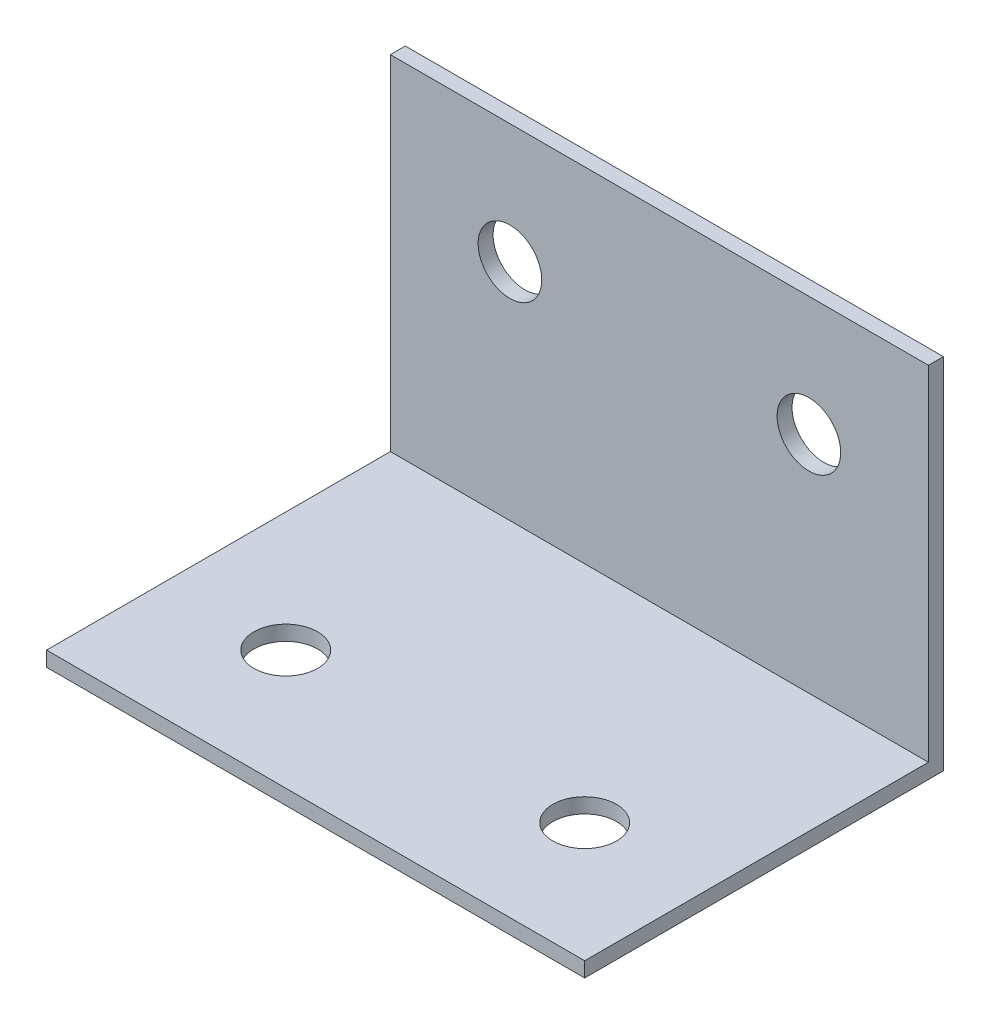
from build123d import *

# Parameters (mm, degrees)
SKETCH1_W                    = 57.15
SKETCH1_H                    = 38.1
BASE_FLANGE1_DEPTH           = 1.5875
EDGE_FLANGE1_STRIP_W         = 7.9375
EDGE_FLANGE1_STRIP_H         = 1.5875
EDGE_FLANGE1_STRIP_CUT_DEPTH = 57.15
EDGE_FLANGE1_DEPTH           = 57.15
F_1_4_CLEARANCE_HOLE1_D      = 6.7564
F_1_4_CLEARANCE_HOLE2_D      = 6.7564
BOSS_EXTRUDE1_DEPTH          = 57.15
CUT_EXTRUDE1_DEPTH           = 79.545162168
BOSS_EXTRUDE2_DEPTH          = 3.175
BOSS_EXTRUDE3_DEPTH          = 3.175


# Sheet-metal steps are written as plain solids
with BuildPart() as part:
    # Sketch1 → Base-Flange1 (new body)
    with BuildSketch(Plane(origin=(0, 0, 0), x_dir=(1, 0, 0), z_dir=(0, 1, 0))):
        with Locations((0, -19.05)):
            Rectangle(SKETCH1_W, SKETCH1_H)
    extrude(amount=BASE_FLANGE1_DEPTH)

    # Edge-Flange1 strip (across the edge) → Edge-Flange1 strip cut (cut)
    with BuildSketch(Plane(origin=(28.575, 1.5875, 0), x_dir=(0, 0, 1), z_dir=(-1, 0, 0))):
        with Locations((-1.5875, -0.79375)):
            Rectangle(EDGE_FLANGE1_STRIP_W, EDGE_FLANGE1_STRIP_H)
    extrude(amount=EDGE_FLANGE1_STRIP_CUT_DEPTH, mode=Mode.SUBTRACT)

    # Edge-Flange1 section (across the edge) → Edge-Flange1 (add)
    with BuildSketch(Plane(origin=(28.575, 1.5875, 0), x_dir=(0, 0, 1), z_dir=(-1, 0, 0))):
        with BuildLine():
            Line((0, 0.79375), (0, 36.5125))
            Line((0, 36.5125), (1.5875, 36.5125))
            Line((1.5875, 36.5125), (1.5875, 0.79375))
            ThreePointArc((1.5875, 0.79375), (1.819983992, 0.232483992), (2.38125, 0))
            Line((2.38125, 0), (2.38125, -1.5875))
            ThreePointArc((2.38125, -1.5875), (0.697451977, -0.890048023), (0, 0.79375))
        make_face()
    extrude(amount=EDGE_FLANGE1_DEPTH)

    # 1/4 Clearance Hole1 (through all)
    with Locations(Plane(origin=(0, 1.5875, 0), x_dir=(1, 0, 0), z_dir=(0, 1, 0))):
        with Locations((-15.875, -25.4), (15.875, -25.4)):
            Hole(F_1_4_CLEARANCE_HOLE1_D / 2)

    # 1/4 Clearance Hole2 (through all)
    with Locations(Plane.XY.offset(1.5875)):
        with Locations((-15.875, 25.4), (15.875, 25.4)):
            Hole(F_1_4_CLEARANCE_HOLE2_D / 2)

    # Sketch16 → Boss-Extrude1 (add, through all)
    with BuildSketch(Plane(origin=(28.575, 0, 0), x_dir=(0, 0, -1), z_dir=(1, 0, 0))):
        with BuildLine():
            Line((0, 2.38125), (0, 0))
            Line((0, 0), (-2.38125, 0))
            ThreePointArc((-2.38125, 0), (-0.697451977, 0.697451977), (0, 2.38125))
        make_face()
    extrude(amount=-BOSS_EXTRUDE1_DEPTH)

    # Sketch18 → Cut-Extrude1 (cut, through all)
    with BuildSketch(Plane(origin=(28.575, 0, 0), x_dir=(0, 0, -1), z_dir=(1, 0, 0))):
        with BuildLine():
            Line((-2.38125, 1.5875), (-1.5875, 1.5875))
            Line((-1.5875, 1.5875), (-1.5875, 2.38125))
            ThreePointArc((-1.5875, 2.38125), (-1.819983992, 1.819983992), (-2.38125, 1.5875))
        make_face()
    extrude(amount=-CUT_EXTRUDE1_DEPTH, mode=Mode.SUBTRACT)

    # Sketch21 → Boss-Extrude2 (add)
    with BuildSketch(Plane(origin=(28.575, 0, 0), x_dir=(0, 0, -1), z_dir=(1, 0, 0))):
        Polygon((-1.5875, 1.5875), (-38.1, 1.5875), (-38.1, 0), (0, 0), (0, 38.1), (-1.5875, 38.1), align=None)
    extrude(amount=-BOSS_EXTRUDE2_DEPTH)

    # Sketch22 → Boss-Extrude3 (add)
    with BuildSketch(Plane.ZY.offset(28.575)):
        Polygon((38.1, 1.5875), (1.5875, 1.5875), (1.5875, 38.1), (0, 38.1), (0, 0), (38.1, 0), align=None)
    extrude(amount=-BOSS_EXTRUDE3_DEPTH)


solid = part.part
